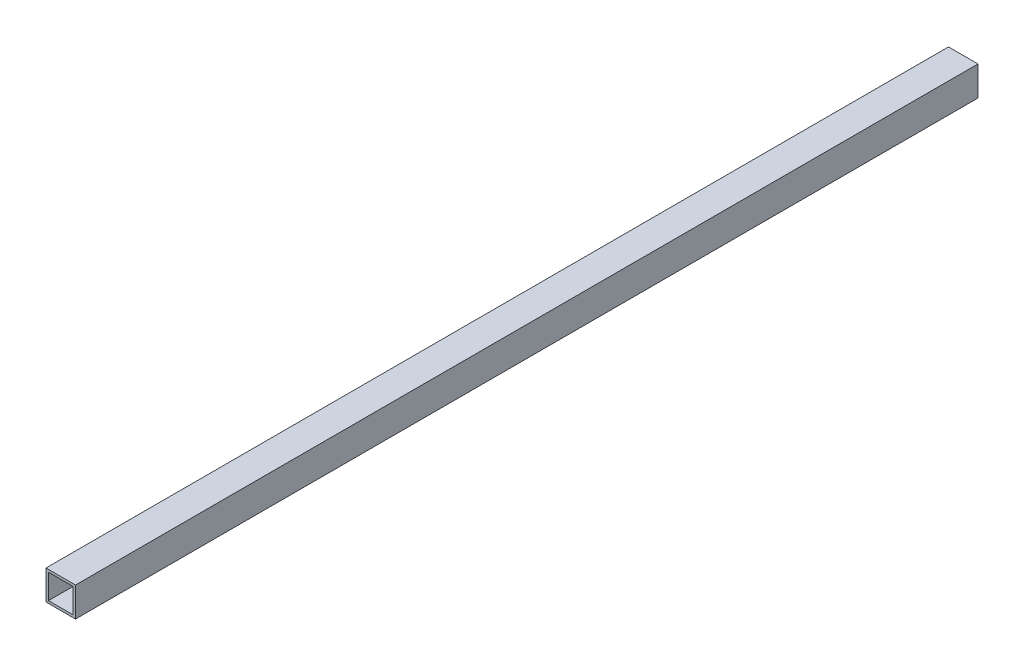
from build123d import *

# Parameters (mm, degrees)
SKETCH1_W           = 19.05
SKETCH1_H           = 19.05
BOSS_EXTRUDE1_DEPTH = 582.676
SKETCH2_W           = 15.875
SKETCH2_H           = 15.875
CUT_EXTRUDE1_DEPTH  = 584.174287538


with BuildPart() as part:
    # Sketch1 → Boss-Extrude1 (new body)
    with BuildSketch(Plane.XY):
        with Locations((-9.409193343, 5.388919414)):
            Rectangle(SKETCH1_W, SKETCH1_H)
    extrude(amount=BOSS_EXTRUDE1_DEPTH)

    # Sketch2 → Cut-Extrude1 (cut, through all)
    with BuildSketch(Plane(origin=(0, 0, 0), x_dir=(-1, 0, 0), z_dir=(0, 0, -1))):
        with Locations((9.409193343, 5.388919414)):
            Rectangle(SKETCH2_W, SKETCH2_H)
    extrude(amount=-CUT_EXTRUDE1_DEPTH, mode=Mode.SUBTRACT)


solid = part.part
